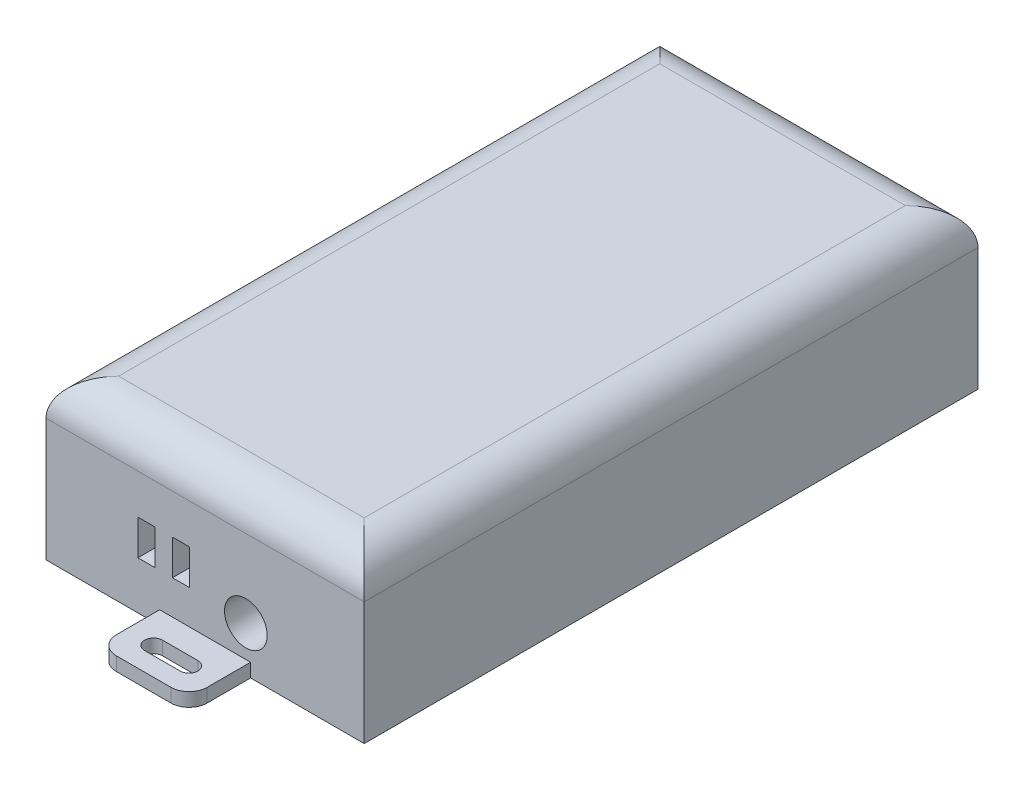
from build123d import *

# Parameters (mm, degrees)
SKETCH1_W           = 44.45
SKETCH1_H           = 85.725
BOSS_EXTRUDE1_DEPTH = 22.225
FILLET1_R           = 5.08
SKETCH2_R           = 2.981516586
CUT_EXTRUDE1_DEPTH  = 12.7
SKETCH3_W           = 2.38773998
SKETCH3_H           = 4.914706725
SKETCH3_W_2         = 2.387739981
CUT_EXTRUDE2_DEPTH  = 7.62
SKETCH4_W           = 3.327455713
SKETCH4_H           = 5.359264955
SKETCH4_W_2         = 3.327455714
CUT_EXTRUDE3_DEPTH  = 7.62
BOSS_EXTRUDE2_DEPTH = 1.905


with BuildPart() as part:
    # Sketch1 → Boss-Extrude1 (new body)
    with BuildSketch(Plane(origin=(0, 0, 0), x_dir=(1, 0, 0), z_dir=(0, 1, 0))):
        with Locations((22.225, 42.8625)):
            Rectangle(SKETCH1_W, SKETCH1_H)
    extrude(amount=BOSS_EXTRUDE1_DEPTH)

    # Fillet1
    fillet1_edges = [part.edges().sort_by_distance(p)[0] for p in [
        (22.225, 22.225, -85.725),
        (44.45, 22.225, -42.8625),
        (22.225, 22.225, 0),
        (0, 22.225, -42.8625),
    ]]
    fillet(fillet1_edges, radius=FILLET1_R)

    # Sketch2 → Cut-Extrude1 (cut)
    with BuildSketch(Plane.XY):
        with Locations((27.915098323, 6.294196756)):
            Circle(SKETCH2_R)
    extrude(amount=-CUT_EXTRUDE1_DEPTH, mode=Mode.SUBTRACT)

    # Sketch3 → Cut-Extrude2 (cut)
    with BuildSketch(Plane.XY):
        with Locations((14.031826574, 9.129741005)):
            Rectangle(SKETCH3_W, SKETCH3_H)
        with Locations((18.859604577, 9.129741005)):
            Rectangle(SKETCH3_W_2, SKETCH3_H)
    extrude(amount=-CUT_EXTRUDE2_DEPTH, mode=Mode.SUBTRACT)

    # Sketch4 → Cut-Extrude3 (cut)
    with BuildSketch(Plane(origin=(0, 0, -85.725), x_dir=(-1, 0, 0), z_dir=(0, 0, -1))):
        with Locations((-29.15965328, 6.872202453)):
            Rectangle(SKETCH4_W, SKETCH4_H)
        with Locations((-24.536551093, 6.872202453)):
            Rectangle(SKETCH4_W_2, SKETCH4_H)
        with Locations((-19.913448907, 6.872202453)):
            Rectangle(SKETCH4_W_2, SKETCH4_H)
        with Locations((-15.290346721, 6.872202453)):
            Rectangle(SKETCH4_W, SKETCH4_H)
    extrude(amount=-CUT_EXTRUDE3_DEPTH, mode=Mode.SUBTRACT)

    # Sketch5 → Boss-Extrude2 (add)
    with BuildSketch(Plane.XZ):
        with BuildLine():
            Line((15.875, 0), (15.875, 6.058263516))
            ThreePointArc((15.875, 6.058263516), (16.618948776, 7.85431474), (18.415, 8.598263516))
            Line((18.415, 8.598263516), (26.035, 8.598263516))
            ThreePointArc((26.035, 8.598263516), (27.831051224, 7.85431474), (28.575, 6.058263516))
            Line((28.575, 6.058263516), (28.575, 0))
            Line((28.575, 0), (15.875, 0))
        make_face()
        with BuildLine():
            Line((19.751425895, 5.984747985), (24.698574105, 5.984747985))
            ThreePointArc((24.698574105, 5.984747985), (25.952772297, 4.730549793), (24.698574105, 3.476351601))
            Line((24.698574105, 3.476351601), (19.751425895, 3.476351601))
            ThreePointArc((19.751425895, 3.476351601), (18.497227703, 4.730549793), (19.751425895, 5.984747985))
        make_face(mode=Mode.SUBTRACT)
    boss_extrude2 = extrude(amount=-BOSS_EXTRUDE2_DEPTH)

    # Mirror2: Boss-Extrude2 across plane
    add(boss_extrude2.mirror(Plane.XY.offset(-41.789753828)))


solid = part.part
